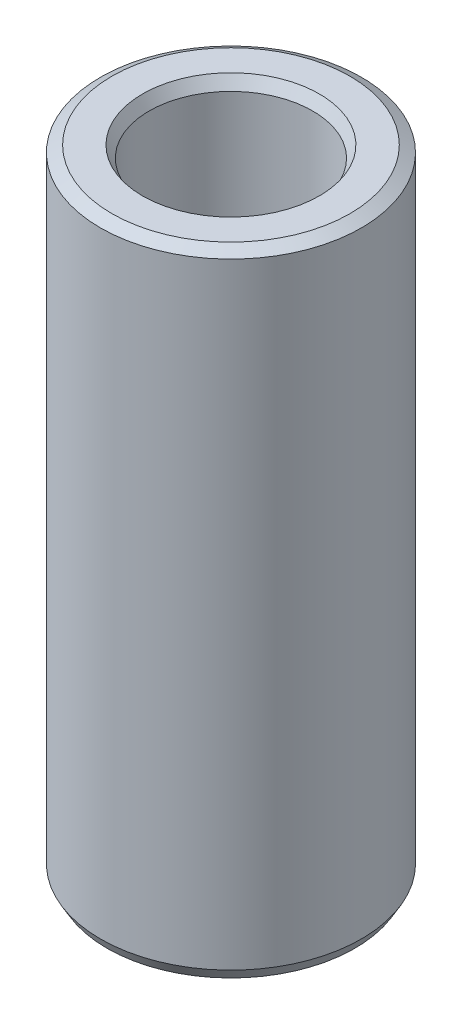
from build123d import *
from OCP.BRepFilletAPI import BRepFilletAPI_MakeChamfer

# Parameters (mm, degrees)
SKETCH1_R           = 27.5
BOSS_EXTRUDE1_DEPTH = 133.564013848
SKETCH2_R           = 17.232351283
CUT_EXTRUDE1_DEPTH  = 140.110911848
CHAMFER1_SIZE       = 1.393631812
CHAMFER1_SIZE2      = 2.413841105


with BuildPart() as part:
    # Sketch1 → Boss-Extrude1 (new body)
    with BuildSketch(Plane(origin=(0, 0, 0), x_dir=(1, 0, 0), z_dir=(0, 1, 0))):
        Circle(SKETCH1_R)
    extrude(amount=BOSS_EXTRUDE1_DEPTH)

    # Sketch2 → Cut-Extrude1 (cut, through all)
    with BuildSketch(Plane(origin=(0, 0, 0), x_dir=(1, 0, 0), z_dir=(0, 1, 0))):
        Circle(SKETCH2_R)
    extrude(amount=CUT_EXTRUDE1_DEPTH, mode=Mode.SUBTRACT)

    # Chamfer1: one chamfer whose edges measure the first distance from different faces: ONE call of the kernel's chamfer builder (chamfer() names one face for all edges)
    chamfer1_edges_1 = [part.edges().sort_by_distance(p)[0] for p in [
        (-17.232351283, 133.564013848, 0),
    ]]
    chamfer1_side_1 = [part.faces().sort_by_distance(p)[0] for p in [
        (-26.722182541, 133.564013848, 0),
    ]]
    chamfer1_edges_2 = [part.edges().sort_by_distance(p)[0] for p in [
        (-17.232351283, 0, 0),
    ]]
    chamfer1_side_2 = [part.faces().sort_by_distance(p)[0] for p in [
        (-17.232351283, 66.782006924, 0),
    ]]
    chamfer1_edges_3 = [part.edges().sort_by_distance(p)[0] for p in [
        (-27.5, 0, 0),
    ]]
    chamfer1_side_3 = [part.faces().sort_by_distance(p)[0] for p in [
        (-26.722182541, 0, 0),
    ]]
    chamfer1_edges_4 = [part.edges().sort_by_distance(p)[0] for p in [
        (-27.5, 133.564013848, 0),
    ]]
    chamfer1_side_4 = [part.faces().sort_by_distance(p)[0] for p in [
        (-27.5, 66.782006924, 0),
    ]]
    chamfer1 = BRepFilletAPI_MakeChamfer(part.part.solid().wrapped)
    for e in chamfer1_edges_1:
        chamfer1.Add(CHAMFER1_SIZE, CHAMFER1_SIZE2, e.wrapped, chamfer1_side_1[0].wrapped)  # the first distance lies on this face
    for e in chamfer1_edges_2:
        chamfer1.Add(CHAMFER1_SIZE, CHAMFER1_SIZE2, e.wrapped, chamfer1_side_2[0].wrapped)  # the first distance lies on this face
    for e in chamfer1_edges_3:
        chamfer1.Add(CHAMFER1_SIZE, CHAMFER1_SIZE2, e.wrapped, chamfer1_side_3[0].wrapped)  # the first distance lies on this face
    for e in chamfer1_edges_4:
        chamfer1.Add(CHAMFER1_SIZE, CHAMFER1_SIZE2, e.wrapped, chamfer1_side_4[0].wrapped)  # the first distance lies on this face
    add(Compound.cast(chamfer1.Shape()), mode=Mode.REPLACE)


solid = part.part
